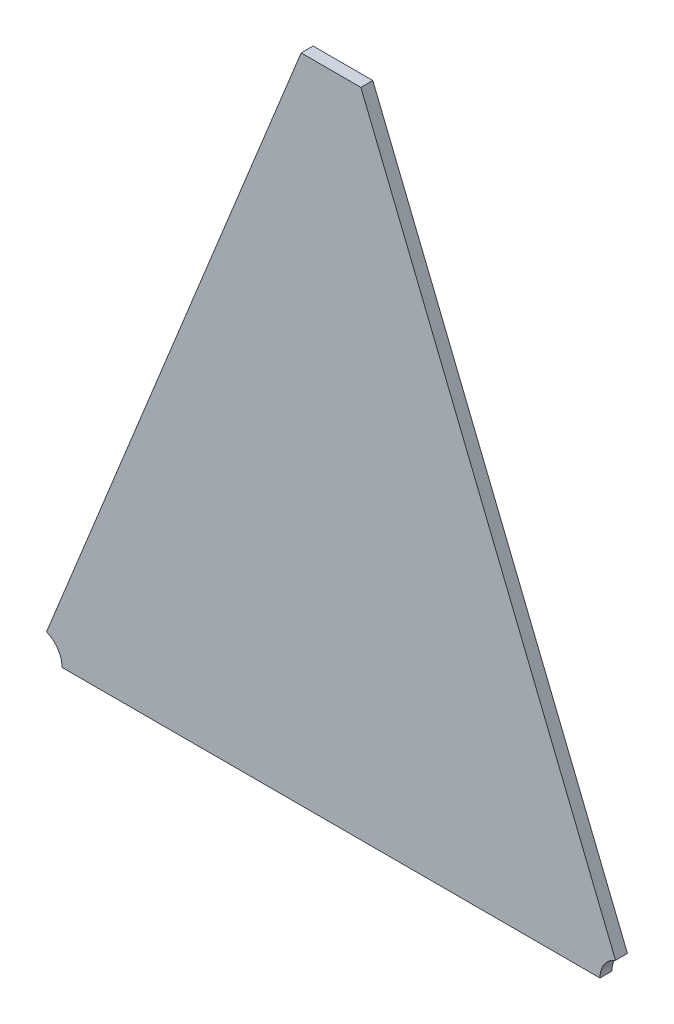
from build123d import *

# Parameters (mm, degrees)
BOSS_EXTRUDE1_DEPTH = 7.62
SKETCH5_R           = 15.875
CUT_EXTRUDE2_DEPTH  = 50.8
SKETCH6_R           = 15.875
CUT_EXTRUDE3_DEPTH  = 50.8


with BuildPart() as part:
    # Sketch2 → Boss-Extrude1 (new body)
    with BuildSketch(Plane.XY):
        Polygon((-189.740054039, 245.383385713), (-358.12852523, -170.414614287), (16.77547477, -170.414614287), (-151.640054039, 245.383385713), align=None)
    extrude(amount=BOSS_EXTRUDE1_DEPTH)

    # Sketch5 → Cut-Extrude2 (cut)
    with BuildSketch(Plane(origin=(0, 0, 0), x_dir=(-1, 0, 0), z_dir=(0, 0, -1))):
        with Locations((358.12852523, -170.414614287)):
            Circle(SKETCH5_R)
    extrude(amount=-CUT_EXTRUDE2_DEPTH, mode=Mode.SUBTRACT)

    # Sketch6 → Cut-Extrude3 (cut)
    with BuildSketch(Plane(origin=(0, 0, 0), x_dir=(-1, 0, 0), z_dir=(0, 0, -1))):
        with Locations((-16.77547477, -170.414614287)):
            Circle(SKETCH6_R)
    extrude(amount=-CUT_EXTRUDE3_DEPTH, mode=Mode.SUBTRACT)


solid = part.part
